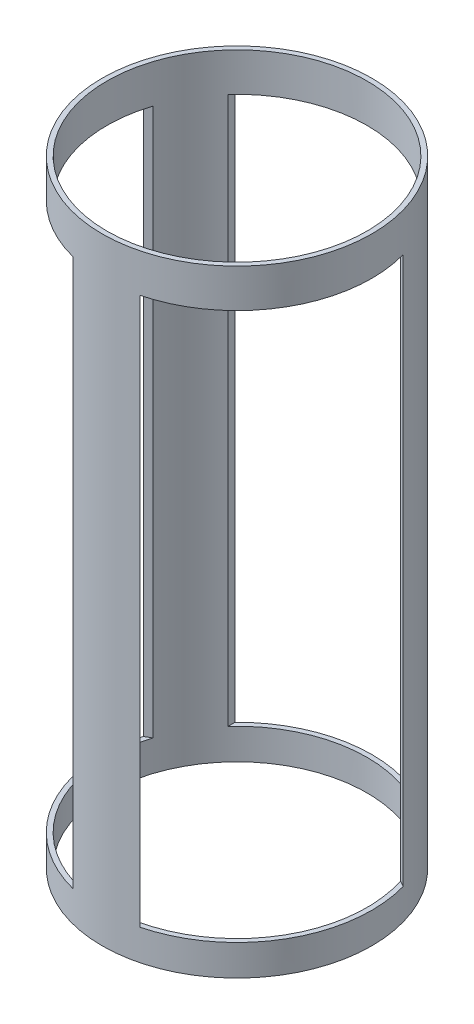
from build123d import *

# Parameters (mm, degrees)
SKETCH1_R               = 88.9
SKETCH1_R_2             = 85.725
BOSS_EXTRUDE1_DEPTH     = 203.2
CUT_EXTRUDE1_REACH      = 240.949
CUT_EXTRUDE1_END_RADIUS = 88.9
SKETCH2_W               = 127
SKETCH2_H               = 360.68
CIRPATTERN1_COUNT       = 3


with BuildPart() as part:
    # Sketch1 → Boss-Extrude1 (new, symmetric)
    with BuildSketch(Plane(origin=(0, 0, 0), x_dir=(1, 0, 0), z_dir=(0, 1, 0))):
        Circle(SKETCH1_R)
        Circle(SKETCH1_R_2, mode=Mode.SUBTRACT)
    extrude(amount=BOSS_EXTRUDE1_DEPTH, both=True)

    # Cut-Extrude1: up to this cylinder (the profile starts inside it)
    cut_extrude1_end = Plane(origin=(0, -2.54, 0), z_dir=(0, -1, 0)) * Cylinder(CUT_EXTRUDE1_END_RADIUS, 660.698, mode=Mode.PRIVATE)
    # Sketch2 → Cut-Extrude1 (cut, up to the surface)
    with BuildSketch(Plane.XY, mode=Mode.PRIVATE) as cut_extrude1_sk1:
        with Locations((0, -2.54)):
            Rectangle(SKETCH2_W, SKETCH2_H)
    cut_extrude1_tool1 = extrude(cut_extrude1_sk1.sketch, amount=-CUT_EXTRUDE1_REACH, mode=Mode.PRIVATE) & cut_extrude1_end
    cut_extrude1 = cut_extrude1_tool1.solids().sort_by_distance((0, -2.54, 0))[0]
    add(cut_extrude1, mode=Mode.SUBTRACT)

    # CirPattern1: Cut-Extrude1 ×3 about axis
    cirpattern1_axis = Axis((0, 203.2, 0), (0, -1, 0))
    for i in range(1, CIRPATTERN1_COUNT):
        add(cut_extrude1.rotate(cirpattern1_axis, i * 360 / CIRPATTERN1_COUNT), mode=Mode.SUBTRACT)


solid = part.part
